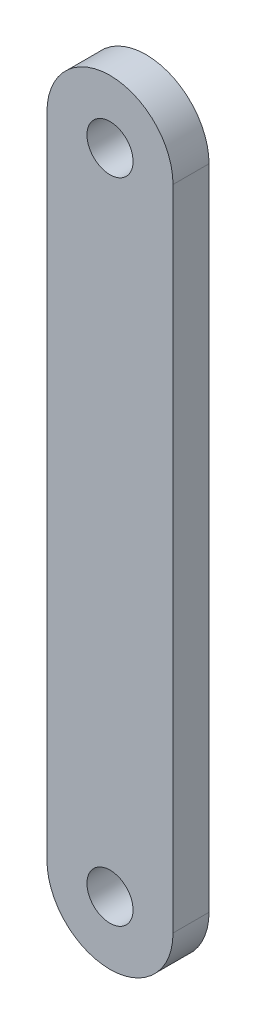
from build123d import *

# Parameters (mm, degrees)
SKETCH1_R           = 3.2512
BOSS_EXTRUDE1_DEPTH = 5.08


with BuildPart() as part:
    # Sketch1 → Boss-Extrude1 (new body)
    with BuildSketch(Plane.XY):
        with BuildLine():
            Line((-8.89, 0), (-8.89, 91.44))
            ThreePointArc((-8.89, 91.44), (0, 100.33), (8.89, 91.44))
            Line((8.89, 91.44), (8.89, 0))
            ThreePointArc((8.89, 0), (0, -8.89), (-8.89, 0))
        make_face()
        Circle(SKETCH1_R, mode=Mode.SUBTRACT)
        with Locations((0, 91.44)):
            Circle(SKETCH1_R, mode=Mode.SUBTRACT)
    extrude(amount=BOSS_EXTRUDE1_DEPTH)


solid = part.part
